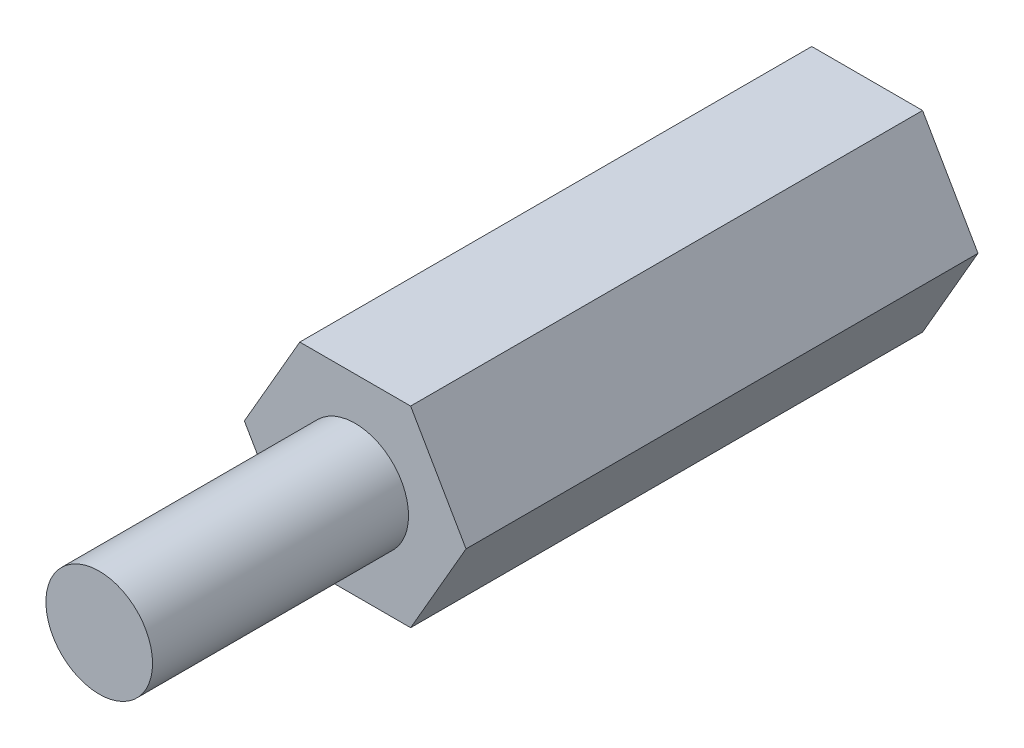
from build123d import *

# Parameters (mm, degrees)
EXTRUDE_1_DEPTH = 12
SKETCH_2_R      = 1.25
EXTRUDE_2_DEPTH = 6


# Read off the part's stored shape, not the designer's step: M3 螺纹孔1
with BuildPart() as part:
    # 草图1 → 凸台-拉伸1 (new body)
    with BuildSketch(Plane.XY):
        Polygon((2.598076211, 0), (1.299038106, 2.25), (-1.299038106, 2.25), (-2.598076211, 0), (-1.299038106, -2.25), (1.299038106, -2.25), align=None)
    extrude(amount=EXTRUDE_1_DEPTH)

    # 草图2 → 凸台-拉伸2 (add)
    with BuildSketch(Plane.XY.offset(12)):
        Circle(SKETCH_2_R)
    extrude(amount=EXTRUDE_2_DEPTH)

    # M3 螺纹孔1 outline → M3 螺纹孔1 (revolve, cut)
    with BuildSketch(Plane.XZ):
        Polygon((1.25, 7.5), (0, 8.251075774), (0, 0), (1.25, 0), align=None)
    revolve(axis=Axis((0, 0, 0), (0, 0, 1)), mode=Mode.SUBTRACT)


solid = part.part
